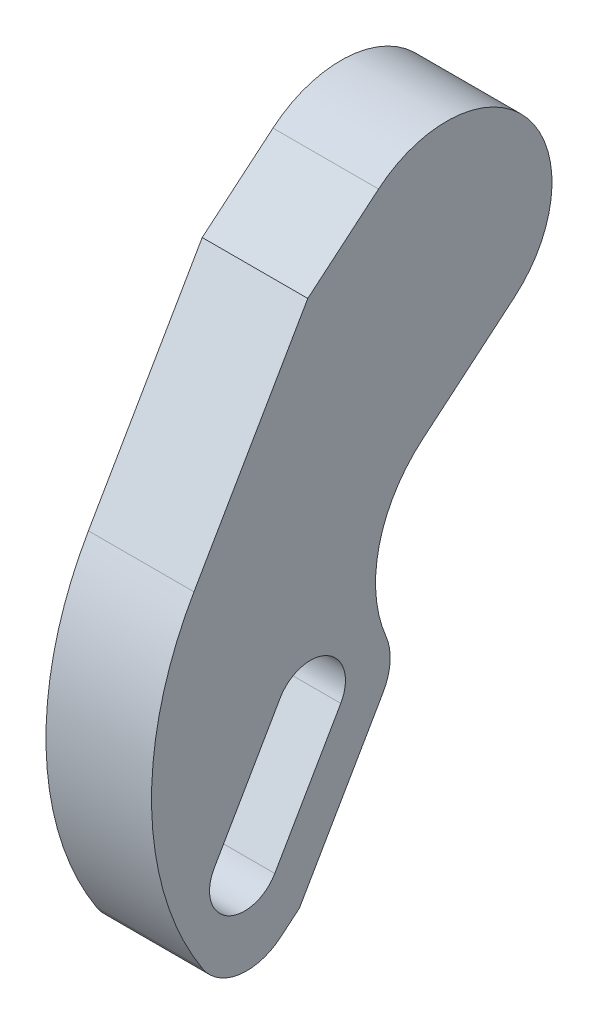
from build123d import *

# Parameters (mm, degrees)
SKETCH5_R           = 4
BOSS_EXTRUDE2_DEPTH = 4
BOSS_EXTRUDE3_DEPTH = 4
SKETCH7_R           = 2.6
CUT_EXTRUDE3_DEPTH  = 2.5
BOSS_EXTRUDE4_DEPTH = 2.5
FILLET1_R           = 0.3
SKETCH9_W           = 4
SKETCH9_H           = 10
BOSS_EXTRUDE5_DEPTH = 7
CUT_EXTRUDE4_REACH  = 29.603
CHAMFER1_SIZE       = 16
CHAMFER1_SIZE2      = 5.823523748
CHAMFER2_SIZE       = 7
CHAMFER2_SIZE2      = 2.54779164
FILLET5_R           = 5
FILLET6_R           = 12
FILLET7_R           = 2


with BuildPart() as part:
    # Sketch5 → Boss-Extrude2 (new body)
    with BuildSketch(Plane(origin=(0, 0, 0), x_dir=(0, 0, -1), z_dir=(1, 0, 0))):
        Circle(SKETCH5_R)
    extrude(amount=BOSS_EXTRUDE2_DEPTH)

    # Sketch6 → Boss-Extrude3 (add)
    with BuildSketch(Plane(origin=(0, 0, 0), x_dir=(0, 0, -1), z_dir=(1, 0, 0))):
        Polygon((-2.571150439, 3.064177772), (2.571150439, -3.064177772), (-12.366716202, -15.598536161), (-17.50901708, -9.470180616), align=None)
    extrude(amount=BOSS_EXTRUDE3_DEPTH)

    # Sketch7 → Cut-Extrude3 (cut)
    with BuildSketch(Plane.ZY):
        Circle(SKETCH7_R)
    extrude(amount=-CUT_EXTRUDE3_DEPTH, mode=Mode.SUBTRACT)

    # Sketch8 → Boss-Extrude4 (add)
    with BuildSketch(Plane.ZY.offset(-2.5)):
        Polygon((1.6, -0.75), (-1.6, -0.75), (-1.6, 0.75), (-0.65, 0.75), (-0.65, 1.25), (0.65, 1.25), (0.65, 0.75), (1.6, 0.75), align=None)
    extrude(amount=BOSS_EXTRUDE4_DEPTH)

    # Fillet1
    fillet1_edges = [part.edges().sort_by_distance(p)[0] for p in [
        (1.25, -0.75, 1.6),
        (1.25, 0.75, 1.6),
        (1.25, 0.75, -1.6),
        (1.25, -0.75, -1.6),
    ]]
    fillet(fillet1_edges, radius=FILLET1_R)

    # Sketch9 → Boss-Extrude5 (add)
    with BuildSketch(Plane(origin=(0, -3.064177772, -2.571150439), x_dir=(1, 0, 0), z_dir=(0, -0.766044443118976, -0.6427876096865419))):
        with Locations((2, 14.5)):
            Rectangle(SKETCH9_W, SKETCH9_H)
    extrude(amount=BOSS_EXTRUDE5_DEPTH)

    # Sketch10 → Cut-Extrude4 (cut, up to next)
    with BuildSketch(Plane(origin=(4, 0, 0), x_dir=(0, 0, -1), z_dir=(1, 0, 0)), mode=Mode.PRIVATE) as cut_extrude4_sk1:
        with BuildLine():
            Line((-4.00251634, -13.097436491), (-6.50251634, -17.427563509))
            ThreePointArc((-6.50251634, -17.427563509), (-8.3125, -17.912547169), (-8.79748366, -16.102563509))
            Line((-8.79748366, -16.102563509), (-6.29748366, -11.772436491))
            ThreePointArc((-6.29748366, -11.772436491), (-4.4875, -11.287452831), (-4.00251634, -13.097436491))
        make_face()
    cut_extrude4_tool1 = extrude(cut_extrude4_sk1.sketch, amount=-CUT_EXTRUDE4_REACH, mode=Mode.PRIVATE) & part.part
    add(cut_extrude4_tool1.solids().sort_by_distance((4, -14.6, 6.4))[0], mode=Mode.SUBTRACT)

    # Chamfer1
    chamfer1_edges = [part.edges().sort_by_distance(p)[0] for p in [
        (2, -9.470180616, 17.50901708),
    ]]
    chamfer1_side = [part.faces().sort_by_distance(p)[0] for p in [
        (2, -3.203001422, 10.040083759),
    ]]
    chamfer(chamfer1_edges, length=CHAMFER1_SIZE, length2=CHAMFER1_SIZE2, reference=chamfer1_side[0])

    # Chamfer2
    chamfer2_edges = [part.edges().sort_by_distance(p)[0] for p in [
        (2, -14.532971166, 0.206758503),
    ]]
    chamfer2_side = [part.faces().sort_by_distance(p)[0] for p in [
        (2, -17.746909215, 4.036980719),
    ]]
    chamfer(chamfer2_edges, length=CHAMFER2_SIZE, length2=CHAMFER2_SIZE2, reference=chamfer2_side[0])

    # Fillet5
    # the kernel refuses this fillet: 5 mm, written as the material it adds along each edge
    with BuildSketch(Plane(origin=(4, -9.170660064, 4.706271771), x_dir=(0, -0.7660444431189757, -0.6427876096865421), z_dir=(-1, 0, 0))) as fillet5_piece_1:
        with BuildLine():
            CenterArc((5, -4.969901842), FILLET5_R, 96.289855747, 83.710144253)
            Line((0, -4.969901842), (-0.1, -4.969901842))
            Line((-0.1, -4.969901842), (-0.1, 0))
            Line((-0.1, 0), (0, 0.1))
            ThreePointArc((0, 0.1), (2.22610418, 0.1), (4.441252527, 0.099398037))
            Line((4.441252527, 0.099398037), (4.45220836, 0))
        make_face()
    extrude(amount=4)

    # Fillet6
    fillet6_edges = [part.edges().sort_by_distance(p)[0] for p in [
        (2, -13.931258623, 13.765728169),
    ]]
    fillet(fillet6_edges, radius=FILLET6_R)

    # Fillet7
    fillet7_edges = [part.edges().sort_by_distance(p)[0] for p in [
        (2, -12.581249538, 1.844447401),
        (2, -20.960847263, 7.867202934),
    ]]
    fillet(fillet7_edges, radius=FILLET7_R)


solid = part.part
